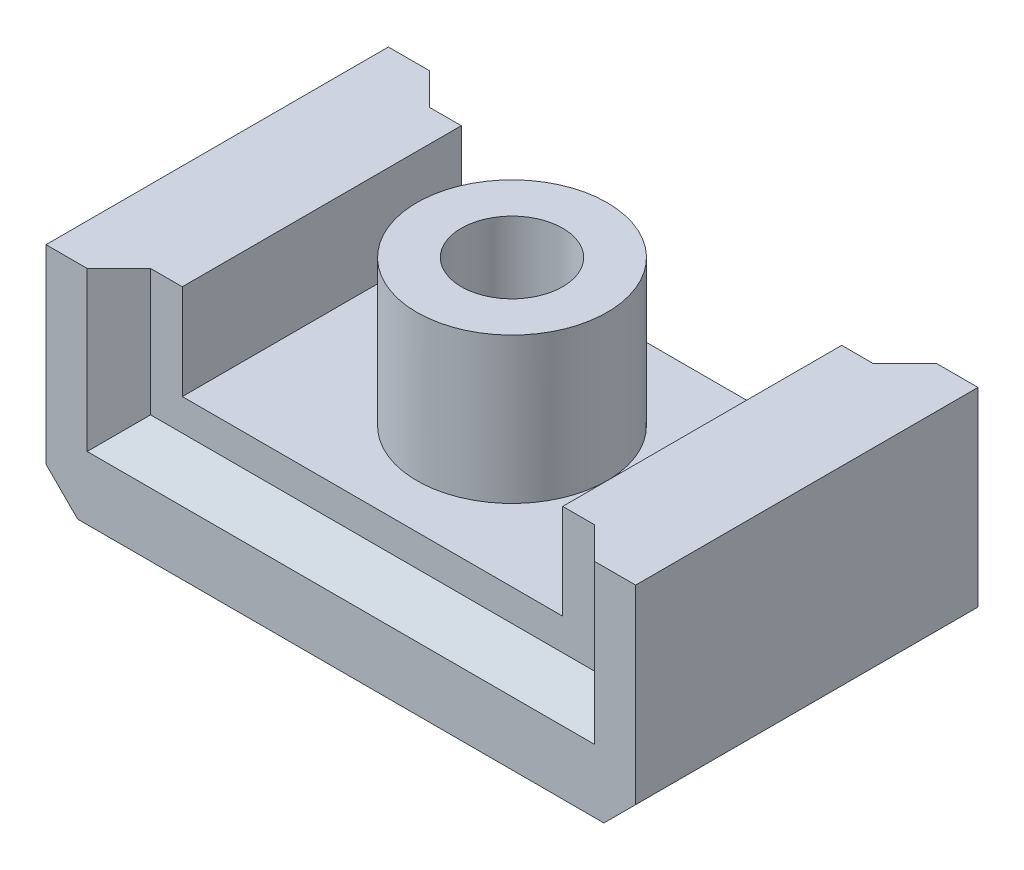
from build123d import *

# Parameters (mm, degrees)
BOSS_EXTRUDE1_DEPTH      = 10.8
SKETCH2_R                = 3
BOSS_EXTRUDE2_DEPTH      = 4.6
SKETCH3_R                = 1.6
CUT_EXTRUDE1_DEPTH       = 24.163764806
CHAMFER1_SIZE            = 1
SKETCH4_W                = 16
SKETCH4_H                = 5
CUT_EXTRUDE2_DEPTH       = 1
CHAMFER2_SIZE            = 1
CHAMFER2_OF_MIRROR1_SIZE = 1


with BuildPart() as part:
    # Sketch1 → Boss-Extrude1 (new body)
    with BuildSketch(Plane.XY):
        Polygon((0, 0), (18.6, 0), (18.6, 7), (15.3, 7), (15.3, 4), (3.3, 4), (3.3, 7), (0, 7), align=None)
    extrude(amount=BOSS_EXTRUDE1_DEPTH)

    # Sketch2 → Boss-Extrude2 (add)
    with BuildSketch(Plane(origin=(0, 4, 0), x_dir=(1, 0, 0), z_dir=(0, 1, 0))):
        with Locations(Location((9.3, -5.4, 0), (0, 0, 90))):
            Circle(SKETCH2_R)
    extrude(amount=BOSS_EXTRUDE2_DEPTH)

    # Sketch3 → Cut-Extrude1 (cut, through all)
    with BuildSketch(Plane(origin=(0, 8.6, 0), x_dir=(1, 0, 0), z_dir=(0, 1, 0))):
        with Locations(Location((9.3, -5.4, 0), (0, 0, 270))):
            Circle(SKETCH3_R)
    extrude(amount=-CUT_EXTRUDE1_DEPTH, mode=Mode.SUBTRACT)

    # Chamfer1
    chamfer1_edges = [part.edges().sort_by_distance(p)[0] for p in [
        (18.6, 0, 5.4),
        (0, 0, 5.4),
    ]]
    chamfer(chamfer1_edges, length=CHAMFER1_SIZE)

    # Sketch4 → Cut-Extrude2 (cut)
    with BuildSketch(Plane(origin=(0, 0, 0), x_dir=(-1, 0, 0), z_dir=(0, 0, -1))):
        with Locations((-9.3, 4.5)):
            Rectangle(SKETCH4_W, SKETCH4_H)
    cut_extrude2 = extrude(amount=-CUT_EXTRUDE2_DEPTH, mode=Mode.SUBTRACT)

    # Chamfer2
    chamfer2_edges = [part.edges().sort_by_distance(p)[0] for p in [
        (1.3, 4.5, 1),
        (17.3, 4.5, 1),
        (9.3, 2, 1),
    ]]
    chamfer(chamfer2_edges, length=CHAMFER2_SIZE - 0.0001)  # a hair under: the kernel refuses the full size

    # Mirror1: Cut-Extrude2 across plane
    add(cut_extrude2.mirror(Plane(origin=(0, 0, 5.4), x_dir=(1, 0, 0), z_dir=(0, 0, -1))), mode=Mode.SUBTRACT)

    # Chamfer2 of Mirror1
    chamfer2_of_mirror1_edges = [part.edges().sort_by_distance(p)[0] for p in [
        (1.3, 4.5, 9.8),
        (17.3, 4.5, 9.8),
        (9.3, 2, 9.8),
    ]]
    chamfer(chamfer2_of_mirror1_edges, length=CHAMFER2_OF_MIRROR1_SIZE - 0.0001)  # a hair under: the kernel refuses the full size


solid = part.part
